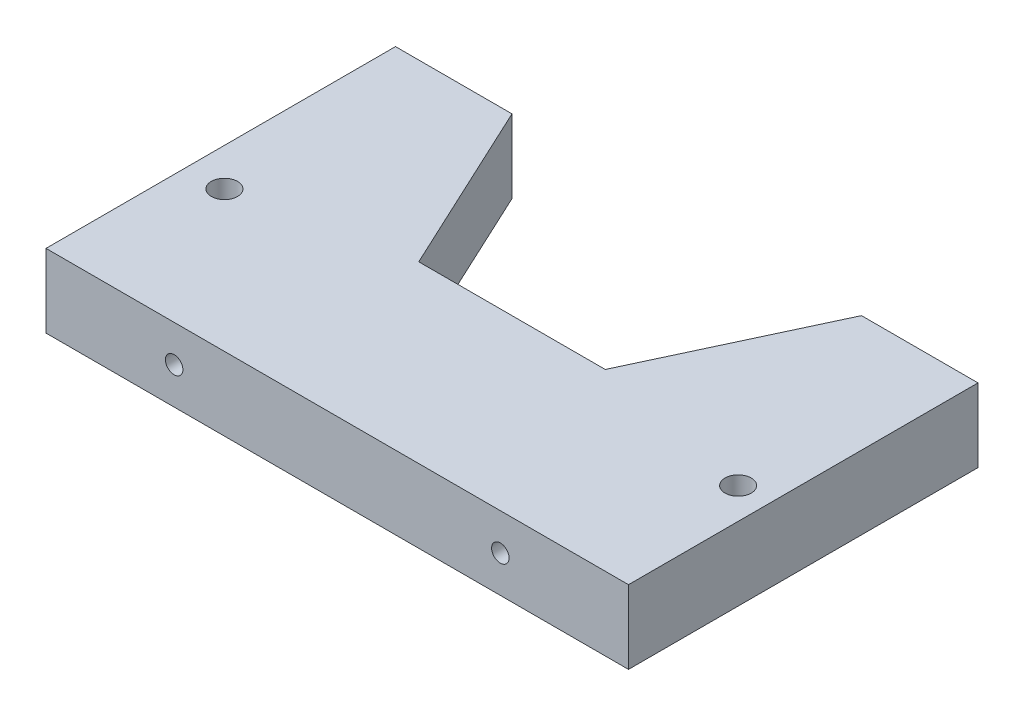
from build123d import *

# Parameters (mm, degrees)
BOSS_EXTRUDE1_DEPTH = 12.6
SKETCH2_R           = 1.5
CUT_EXTRUDE1_DEPTH  = 20
CUT_EXTRUDE2_REACH  = 61.655
SKETCH3_R           = 2.25


with BuildPart() as part:
    # Sketch1 → Boss-Extrude1 (new body)
    with BuildSketch(Plane(origin=(0, 0, 0), x_dir=(1, 0, 0), z_dir=(0, 1, 0))):
        Polygon((-30, 30), (-16.00813249, 0), (16.00813249, 0), (30, 30), (50, 30), (50, -30), (-50, -30), (-50, 30), align=None)
    extrude(amount=BOSS_EXTRUDE1_DEPTH)

    # Sketch2 → Cut-Extrude1 (cut)
    with BuildSketch(Plane.XY.offset(30)):
        with Locations((-28, 6.3)):
            Circle(SKETCH2_R)
        with Locations((28, 6.3)):
            Circle(SKETCH2_R)
    extrude(amount=-CUT_EXTRUDE1_DEPTH, mode=Mode.SUBTRACT)

    # Sketch3 → Cut-Extrude2 (cut, up to next)
    with BuildSketch(Plane.XZ, mode=Mode.PRIVATE) as cut_extrude2_sk1:
        with Locations((44.671841303, 5.85113754)):
            Circle(SKETCH3_R)
    cut_extrude2_tool1 = extrude(cut_extrude2_sk1.sketch, amount=-CUT_EXTRUDE2_REACH, mode=Mode.PRIVATE) & part.part
    # Sketch3 → Cut-Extrude2 (cut, up to next)
    with BuildSketch(Plane.XZ, mode=Mode.PRIVATE) as cut_extrude2_sk2:
        with Locations((-43.519626776, 5.85113754)):
            Circle(SKETCH3_R)
    cut_extrude2_tool2 = extrude(cut_extrude2_sk2.sketch, amount=-CUT_EXTRUDE2_REACH, mode=Mode.PRIVATE) & part.part
    add(cut_extrude2_tool1.solids().sort_by_distance((44.671841, 0, 5.851138))[0], mode=Mode.SUBTRACT)
    add(cut_extrude2_tool2.solids().sort_by_distance((-43.519627, 0, 5.851138))[0], mode=Mode.SUBTRACT)


solid = part.part
